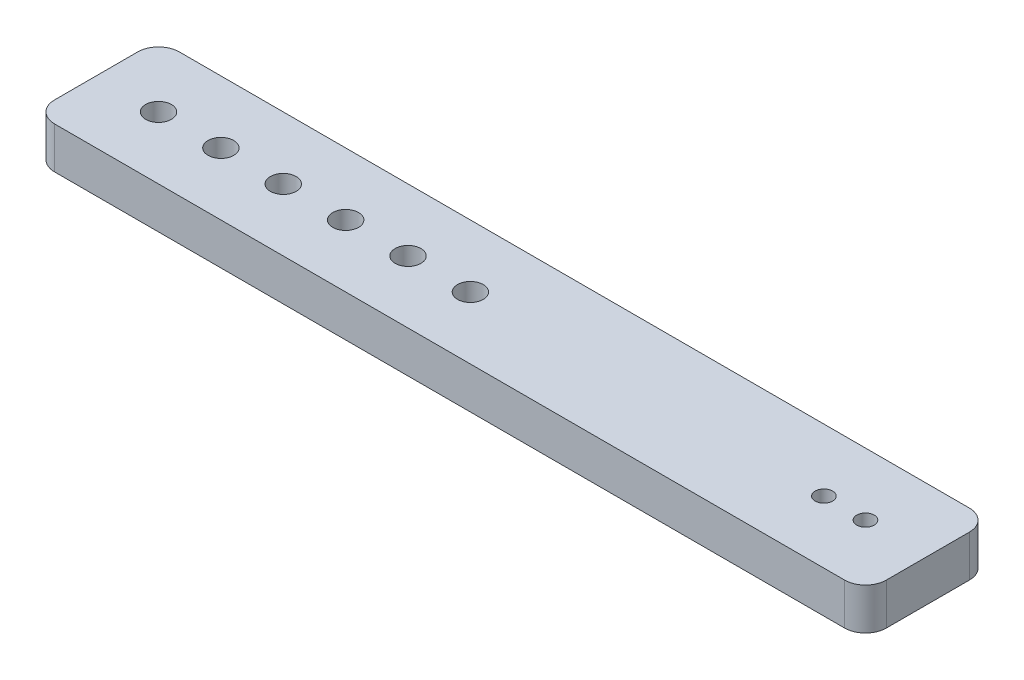
from build123d import *

# Parameters (mm, degrees)
SKETCH1_W           = 200
SKETCH1_H           = 30
BOSS_EXTRUDE1_DEPTH = 10
SKETCH2_R           = 2.1
CUT_EXTRUDE1_DEPTH  = 102.612007165
SKETCH3_R           = 3.1
CUT_EXTRUDE2_DEPTH  = 102.612007165
LPATTERN1_COUNT     = 6
LPATTERN1_PITCH     = 15
FILLET1_R           = 5


with BuildPart() as part:
    # Sketch1 → Boss-Extrude1 (new body)
    with BuildSketch(Plane(origin=(0, 0, 0), x_dir=(1, 0, 0), z_dir=(0, 1, 0))):
        Rectangle(SKETCH1_W, SKETCH1_H)
    extrude(amount=BOSS_EXTRUDE1_DEPTH)

    # Sketch2 → Cut-Extrude1 (cut, through all)
    with BuildSketch(Plane(origin=(0, 10, 0), x_dir=(1, 0, 0), z_dir=(0, 1, 0))):
        with Locations((85, 0)):
            Circle(SKETCH2_R)
        with Locations((75, 0)):
            Circle(SKETCH2_R)
    extrude(amount=-CUT_EXTRUDE1_DEPTH, mode=Mode.SUBTRACT)

    # Sketch3 → Cut-Extrude2 (cut, through all)
    with BuildSketch(Plane(origin=(0, 10, 0), x_dir=(1, 0, 0), z_dir=(0, 1, 0))):
        with Locations((-85, 0)):
            Circle(SKETCH3_R)
    cut_extrude2 = extrude(amount=-CUT_EXTRUDE2_DEPTH, mode=Mode.SUBTRACT)

    # LPattern1: Cut-Extrude2 ×6
    with Locations(*[(i * LPATTERN1_PITCH, 0, 0) for i in range(1, LPATTERN1_COUNT)]):
        add(cut_extrude2, mode=Mode.SUBTRACT)

    # Fillet1
    fillet1_edges = [part.edges().sort_by_distance(p)[0] for p in [
        (100, 5, -15),
        (100, 5, 15),
        (-100, 5, -15),
        (-100, 5, 15),
    ]]
    fillet(fillet1_edges, radius=FILLET1_R)


solid = part.part
